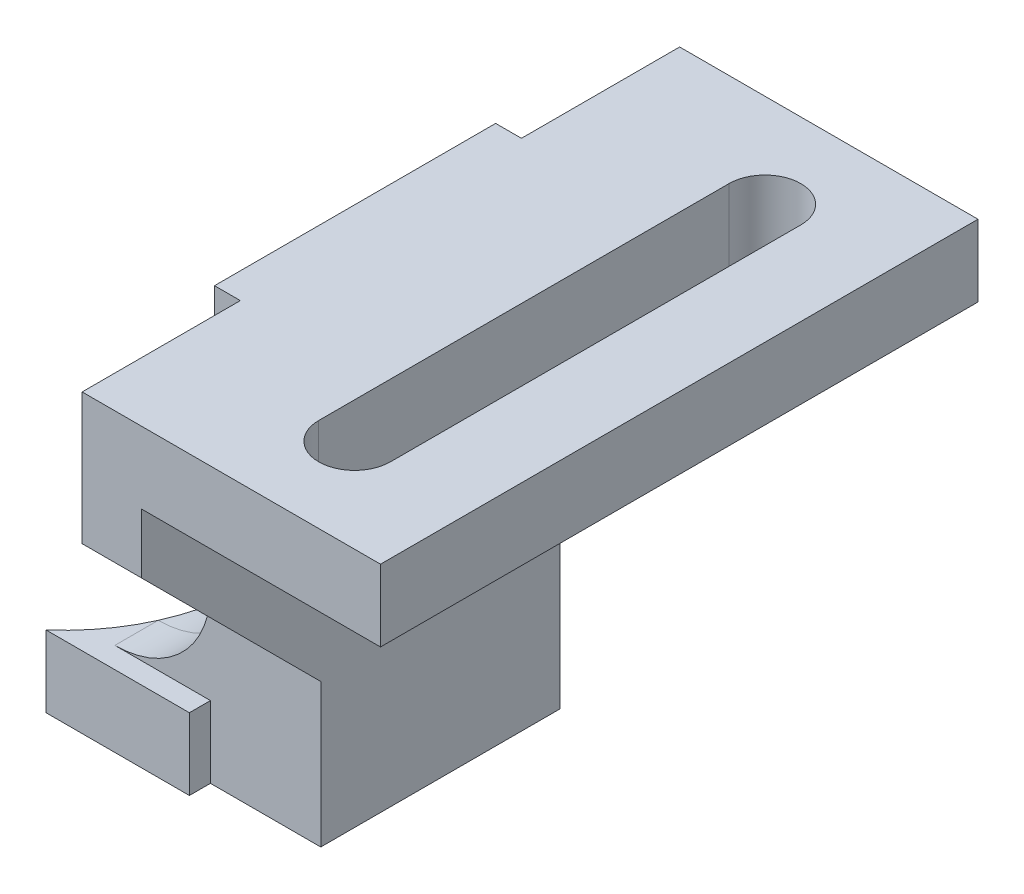
from build123d import *

# Parameters (mm, degrees)
SKETCH1_R               = 1.5
BOSS_EXTRUDE1_DEPTH     = 3
SKETCH3_W               = 4.615398666
SKETCH3_H               = 10
BOSS_EXTRUDE2_DEPTH     = 12.9997796
FILLET7_R               = 1
CUT_EXTRUDE4_DEPTH      = 10
SKETCH9_W               = 13.564457496
SKETCH9_H               = 25
SKETCH9_R               = 1.5
BOSS_EXTRUDE3_DEPTH     = 3
CHAMFER1_SIZE           = 10
CHAMFER2_SIZE           = 10
FILLET8_R               = 4
CUT_EXTRUDE5_DEPTH      = 27.880201216
CUT_EXTRUDE5_DEPTH_BACK = 27.880201216
SKETCH10_W              = 8.131195533
SKETCH10_H              = 6.749631571
SKETCH10_H_2            = 7.013496214
CUT_EXTRUDE6_DEPTH      = 10


with BuildPart() as part:
    # Sketch1 → Boss-Extrude1 (new body)
    with BuildSketch(Plane(origin=(0, 0, 0), x_dir=(1, 0, 0), z_dir=(0, 1, 0))):
        Polygon((-3, -11.32792047), (3, -11.32792047), (3, -5), (7.615398666, -5), (7.615398666, 5), (3, 5), (3, 11.32792047), (-3, 11.32792047), align=None)
        with Locations(Location((0, 8.5, 0), (0, 0, 270))):
            Circle(SKETCH1_R, mode=Mode.SUBTRACT)
        with Locations(Location((0, -8.5, 0), (0, 0, 270))):
            Circle(SKETCH1_R, mode=Mode.SUBTRACT)
    extrude(amount=BOSS_EXTRUDE1_DEPTH)

    # Sketch3 → Boss-Extrude2 (add)
    with BuildSketch(Plane(origin=(0, 3, 0), x_dir=(1, 0, 0), z_dir=(0, 1, 0))):
        with Locations((5.307699333, 0)):
            Rectangle(SKETCH3_W, SKETCH3_H)
    extrude(amount=BOSS_EXTRUDE2_DEPTH)

    # Fillet7
    fillet7_edges = [part.edges().sort_by_distance(p)[0] for p in [
        (3, 1.5, 11.32792047),
        (3, 1.5, -11.32792047),
    ]]
    fillet(fillet7_edges, radius=FILLET7_R)

    # Sketch7 → Cut-Extrude4 (cut)
    with BuildSketch(Plane.XZ):
        with BuildLine():
            Line((-3.65526474, -6.392053518), (-3.78188192, 6.478485425))
            ThreePointArc((-3.78188192, 6.478485425), (-0.319780446, 0.076652438), (-3.65526474, -6.392053518))
        make_face()
    extrude(amount=-CUT_EXTRUDE4_DEPTH, mode=Mode.SUBTRACT)

    # Sketch9 → Boss-Extrude3 (add)
    with BuildSketch(Plane(origin=(0, 15.9997796, 0), x_dir=(1, 0, 0), z_dir=(0, 1, 0))):
        with Locations((10.833169918, 0)):
            Rectangle(SKETCH9_W, SKETCH9_H)
        with Locations(Location((12.615398666, 6, 0), (0, 0, 270))):
            Circle(SKETCH9_R, mode=Mode.SUBTRACT)
        with Locations(Location((12.615398666, -6, 0), (0, 0, 270))):
            Circle(SKETCH9_R, mode=Mode.SUBTRACT)
    extrude(amount=BOSS_EXTRUDE3_DEPTH)

    # Chamfer1
    # the kernel refuses this chamfer: 10 mm, written as the material it adds along each edge
    with BuildSketch(Plane(origin=(4.05094117, 15.9997796, 5), x_dir=(0, -0.9996219169112968, -0.027495876610586403), z_dir=(1, 0, 0))) as chamfer1_piece_1_section:
        Polygon((CHAMFER1_SIZE * 0.999621916911, -CHAMFER1_SIZE * 0.0274958766106), (-CHAMFER1_SIZE * 0.0274958766106, -CHAMFER1_SIZE * 0.999621916911), (0, 0), align=None)
    chamfer1_piece_1 = extrude(amount=3.564457497, mode=Mode.PRIVATE)
    chamfer1_piece_1 = split(chamfer1_piece_1, bisect_by=Plane(origin=(5.833169918, 12.4997796, 12.5), z_dir=(0, 0, -1)), keep=Keep.TOP, mode=Mode.PRIVATE)
    add(chamfer1_piece_1)

    # Chamfer2
    # the kernel refuses this chamfer: 10 mm, written as the material it adds along each edge
    with BuildSketch(Plane(origin=(7.615398666, 15.9997796, -5), x_dir=(0, -0.9996219169112968, 0.027495876610586403), z_dir=(-1, 0, 0))) as chamfer2_piece_1_section:
        Polygon((CHAMFER2_SIZE * 0.999621916911, -CHAMFER2_SIZE * 0.0274958766106), (-CHAMFER2_SIZE * 0.0274958766106, -CHAMFER2_SIZE * 0.999621916911), (0, 0), align=None)
    chamfer2_piece_1 = extrude(amount=3.564457497, mode=Mode.PRIVATE)
    chamfer2_piece_1 = split(chamfer2_piece_1, bisect_by=Plane(origin=(5.833169918, 12.4997796, -12.5), z_dir=(0, 0, 1)), keep=Keep.TOP, mode=Mode.PRIVATE)
    add(chamfer2_piece_1)

    # Fillet8
    fillet8_edges = [part.edges().sort_by_distance(p)[0] for p in [
        (3, 3, 0),
    ]]
    fillet(fillet8_edges, radius=FILLET8_R)

    # Sketch10 → Cut-Extrude5 (cut, two sides: drawn at the far end of the back side and taken through both)
    with BuildSketch(Plane(origin=(0, 3, 0), x_dir=(1, 0, 0), z_dir=(0, 1, 0)).offset(-CUT_EXTRUDE5_DEPTH_BACK)):
        with Locations((1.065597767, 9.256059268)):
            Rectangle(SKETCH10_W, SKETCH10_H)
        with Locations((1.065597767, -9.38799159)):
            Rectangle(SKETCH10_W, SKETCH10_H_2)
    extrude(amount=CUT_EXTRUDE5_DEPTH + CUT_EXTRUDE5_DEPTH_BACK, mode=Mode.SUBTRACT)

    # Sketch11 → Cut-Extrude6 (cut)
    with BuildSketch(Plane(origin=(0, 18.9997796, 0), x_dir=(1, 0, 0), z_dir=(0, 1, 0))):
        with BuildLine():
            Line((14.115398666, 8.584889461), (14.115398666, -8.584889461))
            ThreePointArc((14.115398666, -8.584889461), (12.615398666, -10.084889461), (11.115398666, -8.584889461))
            Line((11.115398666, -8.584889461), (11.115398666, 8.584889461))
            ThreePointArc((11.115398666, 8.584889461), (12.615398666, 10.084889461), (14.115398666, 8.584889461))
        make_face()
    extrude(amount=-CUT_EXTRUDE6_DEPTH, mode=Mode.SUBTRACT)


solid = part.part
